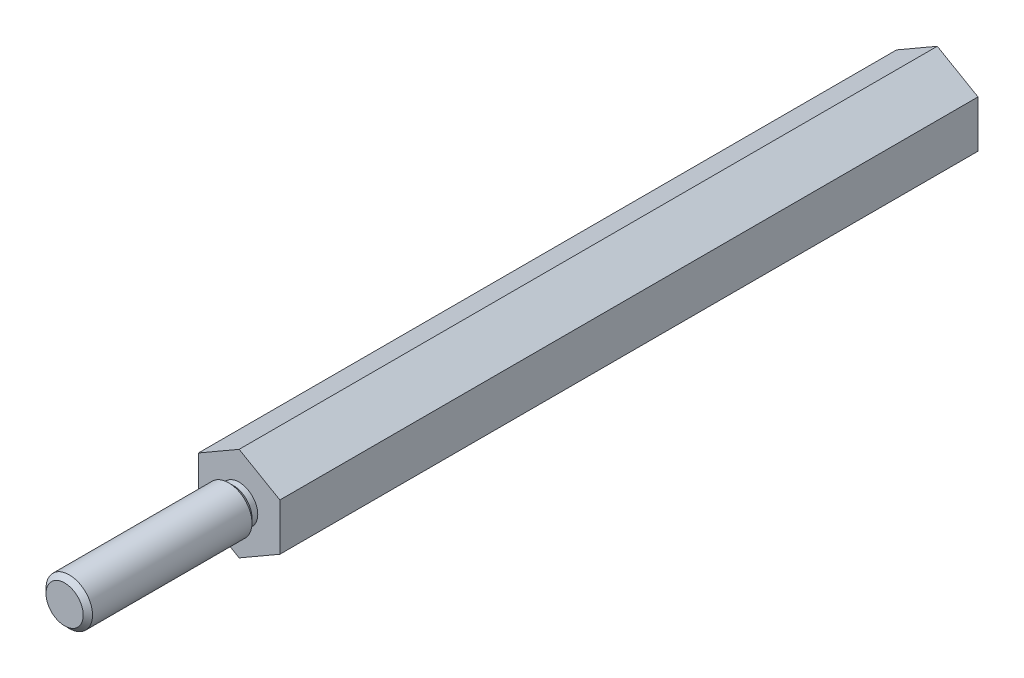
from build123d import *

# Parameters (mm, degrees)
EXTRUDE_1_DEPTH             = 60
SKETCH_2_R                  = 2
EXTRUDE_2_DEPTH             = 15
SKETCH_3_R                  = 2
SKETCH_3_R_2                = 1.6
CUT_EXTRUDE_3_DEPTH         = 0.5
CHAMFER_1_SIZE              = 0.4
HOLE_WIZARD_M31_D           = 2.2
HOLE_WIZARD_M31_DEPTH       = 8
HOLE_WIZARD_M31_CSINK_D     = 3
HOLE_WIZARD_M31_CSINK_ANGLE = 90
HOLE_WIZARD_M31_TIP         = 0.660946681


with BuildPart() as part:
    # Эскиз1 → Вытянуть1 (new body)
    with BuildSketch(Plane.XY):
        Polygon((0, 4.041451884), (-3.5, 2.020725942), (-3.5, -2.020725942), (0, -4.041451884), (3.5, -2.020725942), (3.5, 2.020725942), align=None)
    extrude(amount=EXTRUDE_1_DEPTH)

    # Эскиз2 → Вытянуть2 (add)
    with BuildSketch(Plane.XY.offset(60)):
        Circle(SKETCH_2_R)
    extrude(amount=EXTRUDE_2_DEPTH)

    # Эскиз3 → Вырез-Вытянуть3 (cut)
    with BuildSketch(Plane.XY.offset(60)):
        Circle(SKETCH_3_R)
        Circle(SKETCH_3_R_2, mode=Mode.SUBTRACT)
    extrude(amount=CUT_EXTRUDE_3_DEPTH, mode=Mode.SUBTRACT)

    # Фаска1
    chamfer_1_edges = [part.edges().sort_by_distance(p)[0] for p in [
        (-2, 0, 75),
        (-2, 0, 60.5),
    ]]
    chamfer(chamfer_1_edges, length=CHAMFER_1_SIZE - 0.0001)  # a hair under: the kernel refuses the full size

    # Отверстие с зазором M31
    with Locations(Plane(origin=(0, 0, 0), x_dir=(-1, 0, 0), z_dir=(0, 0, -1))):
        with Locations((0, 0)):
            CounterSinkHole(HOLE_WIZARD_M31_D / 2, HOLE_WIZARD_M31_CSINK_D / 2, depth=HOLE_WIZARD_M31_DEPTH, counter_sink_angle=HOLE_WIZARD_M31_CSINK_ANGLE)
            with Locations((0, 0, -(HOLE_WIZARD_M31_DEPTH + HOLE_WIZARD_M31_TIP / 2))):  # 118° drill point
                Cone(0, HOLE_WIZARD_M31_D / 2, HOLE_WIZARD_M31_TIP, mode=Mode.SUBTRACT)


solid = part.part
